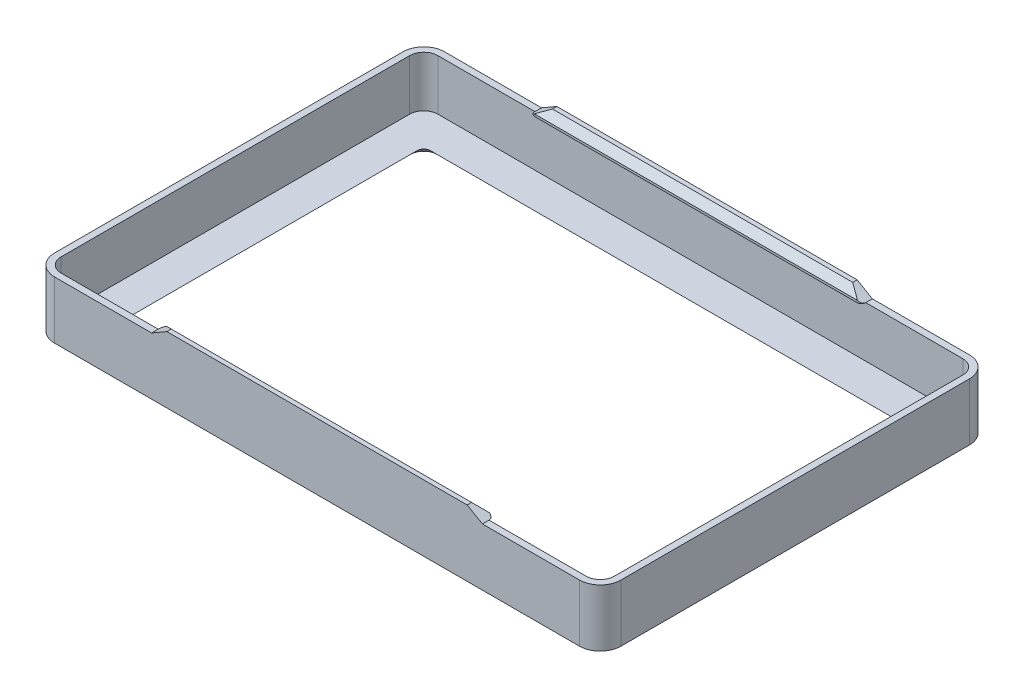
from build123d import *

# Parameters (mm, degrees)
BOSS_EXTRUDE1_DEPTH = 23
BOSS_EXTRUDE2_START = 3
SKETCH2_W           = 218.8
SKETCH2_H           = 138.8
BOSS_EXTRUDE2_DEPTH = 3
FILLET1_R           = 3
CHAMFER1_SIZE       = 3
BOSS_EXTRUDE4_DEPTH = 5
CHAMFER2_SIZE       = 3
CUT_EXTRUDE1_DEPTH  = 5


# Read off the part's stored shape, not the designer's step: Mirror1
with BuildPart() as part:
    # Sketch1 → Boss-Extrude1 (new body)
    with BuildSketch(Plane(origin=(0, 0, 0), x_dir=(1, 0, 0), z_dir=(0, 1, 0))):
        with BuildLine():
            Line((119, 88.4), (-119, 88.4))
            ThreePointArc((-119, 88.4), (-125.646803743, 85.646803743), (-128.4, 79))
            Line((-128.4, 79), (-128.4, -79))
            ThreePointArc((-128.4, -79), (-125.646803743, -85.646803743), (-119, -88.4))
            Line((-119, -88.4), (119, -88.4))
            ThreePointArc((119, -88.4), (125.646803743, -85.646803743), (128.4, -79))
            Line((128.4, -79), (128.4, 79))
            ThreePointArc((128.4, 79), (125.646803743, 85.646803743), (119, 88.4))
        make_face()
        with BuildLine():
            Line((-125.4, 79), (-125.4, -79))
            ThreePointArc((-125.4, -79), (-123.5254834, -83.5254834), (-119, -85.4))
            Line((-119, -85.4), (119, -85.4))
            ThreePointArc((119, -85.4), (123.5254834, -83.5254834), (125.4, -79))
            Line((125.4, -79), (125.4, 79))
            ThreePointArc((125.4, 79), (123.5254834, 83.5254834), (119, 85.4))
            Line((119, 85.4), (-119, 85.4))
            ThreePointArc((-119, 85.4), (-123.5254834, 83.5254834), (-125.4, 79))
        make_face(mode=Mode.SUBTRACT)
    extrude(amount=BOSS_EXTRUDE1_DEPTH)

    # Sketch2 → Boss-Extrude2 (add)
    with BuildSketch(Plane.XZ.offset(BOSS_EXTRUDE2_START)):
        with BuildLine():
            Line((128.4, -79), (128.4, 79))
            ThreePointArc((128.4, 79), (125.646803743, 85.646803743), (119, 88.4))
            Line((119, 88.4), (-119, 88.4))
            ThreePointArc((-119, 88.4), (-125.646803743, 85.646803743), (-128.4, 79))
            Line((-128.4, 79), (-128.4, -79))
            ThreePointArc((-128.4, -79), (-125.646803743, -85.646803743), (-119, -88.4))
            Line((-119, -88.4), (119, -88.4))
            ThreePointArc((119, -88.4), (125.646803743, -85.646803743), (128.4, -79))
        make_face()
        Rectangle(SKETCH2_W, SKETCH2_H, mode=Mode.SUBTRACT)
    extrude(amount=-BOSS_EXTRUDE2_DEPTH)

    # Fillet1
    fillet1_edges = [part.edges().sort_by_distance(p)[0] for p in [
        (109.4, -1.5, 69.4),
        (-109.4, -1.5, 69.4),
        (-109.4, -1.5, -69.4),
        (109.4, -1.5, -69.4),
    ]]
    fillet(fillet1_edges, radius=FILLET1_R)

    # Chamfer1
    chamfer1_edges = [part.edges().sort_by_distance(p)[0] for p in [
        (109.4, -3, 0),
        (108.521320344, -3, 68.521320344),
        (108.521320344, -3, -68.521320344),
        (0, -3, 69.4),
        (0, -3, -69.4),
        (-108.521320344, -3, 68.521320344),
        (-108.521320344, -3, -68.521320344),
        (-109.4, -3, 0),
    ]]
    chamfer(chamfer1_edges, length=CHAMFER1_SIZE - 0.0001)  # a hair under: the kernel refuses the full size

    # Sketch4 → Boss-Extrude4 (add)
    with BuildSketch(Plane.XY.offset(88.4)):
        Polygon((75, 23), (-75, 23), (-68.07179677, 27), (68.07179677, 27), align=None)
    extrude(amount=-BOSS_EXTRUDE4_DEPTH)

    # Chamfer2
    chamfer2_edges = [part.edges().sort_by_distance(p)[0] for p in [
        (0, 27, 83.4),
    ]]
    chamfer(chamfer2_edges, length=CHAMFER2_SIZE)

    # Sketch5 → Cut-Extrude1 (cut)
    with BuildSketch(Plane(origin=(0, 27, 0), x_dir=(1, 0, 0), z_dir=(0, 1, 0))):
        with BuildLine():
            Line((-73, -83.4), (-75, -83.4))
            Line((-75, -83.4), (-75, -85.4))
            ThreePointArc((-75, -85.4), (-74.414213562, -83.985786438), (-73, -83.4))
        make_face()
        with BuildLine():
            Line((75, -83.4), (75, -85.4))
            ThreePointArc((75, -85.4), (74.414213562, -83.985786438), (73, -83.4))
            Line((73, -83.4), (75, -83.4))
        make_face()
    extrude(amount=-CUT_EXTRUDE1_DEPTH, mode=Mode.SUBTRACT)

    # Mirror1: part across plane


with BuildPart() as part_1:
    add(part.part)
    add(part.part.mirror(Plane.XY))


solid = part_1.part
